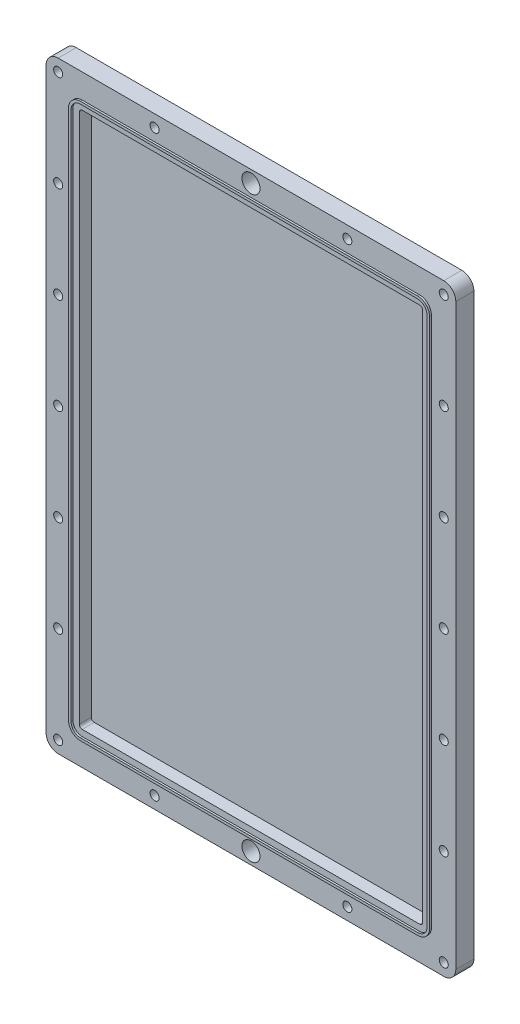
from build123d import *

# Parameters (mm, degrees)
SKETCH1_W           = 215.9
SKETCH1_H           = 317.5
BOSS_EXTRUDE1_DEPTH = 9.525
SKETCH4_R           = 2.38125
CUT_EXTRUDE1_DEPTH  = 385.070026981
CUT_EXTRUDE3_DEPTH  = 6.35
BOSS_EXTRUDE2_DEPTH = 1.016
SKETCH7_R           = 4.7625
CUT_EXTRUDE4_DEPTH  = 385.070026981
FILLET1_R           = 6.35


with BuildPart() as part:
    # Sketch1 → Boss-Extrude1 (new body)
    with BuildSketch(Plane.XY):
        with Locations((107.95, 158.75)):
            Rectangle(SKETCH1_W, SKETCH1_H)
    extrude(amount=BOSS_EXTRUDE1_DEPTH)

    # Sketch4 → Cut-Extrude1 (cut, through all)
    with BuildSketch(Plane.XY.offset(9.525)):
        with Locations((6.35, 6.35)):
            Circle(SKETCH4_R)
        with Locations((6.35, 311.15)):
            Circle(SKETCH4_R)
        with Locations((209.55, 311.15)):
            Circle(SKETCH4_R)
        with Locations((209.55, 6.35)):
            Circle(SKETCH4_R)
        with Locations((57.15, 311.15)):
            Circle(SKETCH4_R)
        with Locations((57.15, 6.35)):
            Circle(SKETCH4_R)
        with Locations((107.95, 311.15)):
            Circle(SKETCH4_R)
        with Locations((107.95, 6.35)):
            Circle(SKETCH4_R)
        with Locations((158.75, 311.15)):
            Circle(SKETCH4_R)
        with Locations((158.75, 6.35)):
            Circle(SKETCH4_R)
        with Locations((6.35, 260.35)):
            Circle(SKETCH4_R)
        with Locations((209.55, 260.35)):
            Circle(SKETCH4_R)
        with Locations((6.35, 209.55)):
            Circle(SKETCH4_R)
        with Locations((209.55, 209.55)):
            Circle(SKETCH4_R)
        with Locations((6.35, 158.75)):
            Circle(SKETCH4_R)
        with Locations((209.55, 158.75)):
            Circle(SKETCH4_R)
        with Locations((6.35, 107.95)):
            Circle(SKETCH4_R)
        with Locations((209.55, 107.95)):
            Circle(SKETCH4_R)
        with Locations((6.35, 57.15)):
            Circle(SKETCH4_R)
        with Locations((209.55, 57.15)):
            Circle(SKETCH4_R)
    extrude(amount=-CUT_EXTRUDE1_DEPTH, mode=Mode.SUBTRACT)

    # Sketch6 → Cut-Extrude3 (cut)
    with BuildSketch(Plane.XY.offset(9.525)):
        with BuildLine():
            Line((196.85, 300.0375), (19.05, 300.0375))
            ThreePointArc((19.05, 300.0375), (17.927467985, 299.572532015), (17.4625, 298.45))
            Line((17.4625, 298.45), (17.4625, 19.05))
            ThreePointArc((17.4625, 19.05), (17.927467985, 17.927467985), (19.05, 17.4625))
            Line((19.05, 17.4625), (196.85, 17.4625))
            ThreePointArc((196.85, 17.4625), (197.972532015, 17.927467985), (198.4375, 19.05))
            Line((198.4375, 19.05), (198.4375, 298.45))
            ThreePointArc((198.4375, 298.45), (197.972532015, 299.572532015), (196.85, 300.0375))
        make_face()
    extrude(amount=-CUT_EXTRUDE3_DEPTH, mode=Mode.SUBTRACT)

    # Sketch5 → Boss-Extrude2 (add)
    with BuildSketch(Plane.XY.offset(9.525)):
        with BuildLine():
            ThreePointArc((19.05, 304.673), (14.649674501, 302.850325499), (12.827, 298.45))
            Line((12.827, 298.45), (12.827, 19.05))
            ThreePointArc((12.827, 19.05), (14.649674501, 14.649674501), (19.05, 12.827))
            Line((19.05, 12.827), (196.85, 12.827))
            ThreePointArc((196.85, 12.827), (201.250325499, 14.649674501), (203.073, 19.05))
            Line((203.073, 19.05), (203.073, 298.45))
            ThreePointArc((203.073, 298.45), (201.250325499, 302.850325499), (196.85, 304.673))
            Line((196.85, 304.673), (19.05, 304.673))
        make_face()
        with BuildLine():
            ThreePointArc((196.85, 303.3395), (200.307398607, 301.907398607), (201.7395, 298.45))
            Line((201.7395, 298.45), (201.7395, 19.05))
            ThreePointArc((201.7395, 19.05), (200.307398607, 15.592601393), (196.85, 14.1605))
            Line((196.85, 14.1605), (19.05, 14.1605))
            ThreePointArc((19.05, 14.1605), (15.592601393, 15.592601393), (14.1605, 19.05))
            Line((14.1605, 19.05), (14.1605, 298.45))
            ThreePointArc((14.1605, 298.45), (15.592601393, 301.907398607), (19.05, 303.3395))
            Line((19.05, 303.3395), (196.85, 303.3395))
        make_face(mode=Mode.SUBTRACT)
    extrude(amount=BOSS_EXTRUDE2_DEPTH)

    # Sketch7 → Cut-Extrude4 (cut, through all)
    with BuildSketch(Plane.XY.offset(9.525)):
        with Locations((107.95, 6.35)):
            Circle(SKETCH7_R)
        with Locations((107.95, 311.15)):
            Circle(SKETCH7_R)
    extrude(amount=-CUT_EXTRUDE4_DEPTH, mode=Mode.SUBTRACT)

    # Fillet1
    fillet1_edges = [part.edges().sort_by_distance(p)[0] for p in [
        (0, 317.5, 4.7625),
        (215.9, 317.5, 4.7625),
        (0, 0, 4.7625),
        (215.9, 0, 4.7625),
    ]]
    fillet(fillet1_edges, radius=FILLET1_R)


solid = part.part
